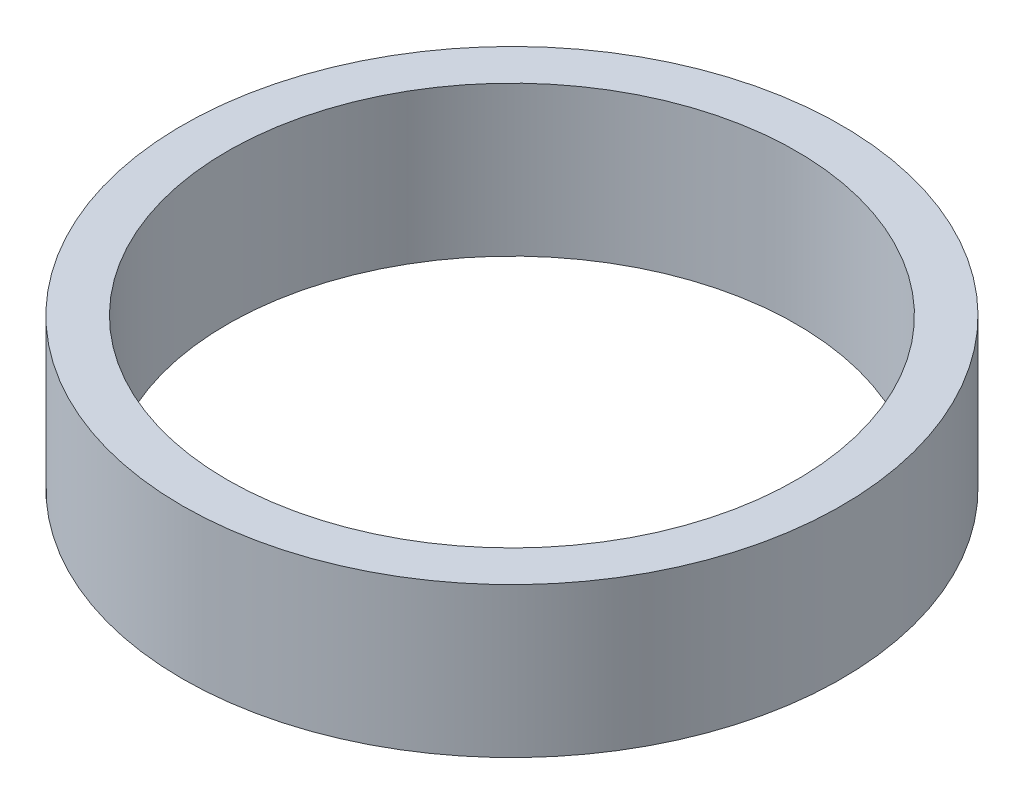
from build123d import *

# Parameters (mm, degrees)
SKETCH1_R           = 55
BOSS_EXTRUDE1_DEPTH = 25
SKETCH2_R           = 47.5
CUT_EXTRUDE1_DEPTH  = 82.700673192


with BuildPart() as part:
    # Sketch1 → Boss-Extrude1 (new body)
    with BuildSketch(Plane(origin=(0, 0, 0), x_dir=(1, 0, 0), z_dir=(0, 1, 0))):
        Circle(SKETCH1_R)
    extrude(amount=BOSS_EXTRUDE1_DEPTH)

    # Sketch2 → Cut-Extrude1 (cut, through all)
    with BuildSketch(Plane(origin=(0, 0, 0), x_dir=(1, 0, 0), z_dir=(0, 1, 0))):
        Circle(SKETCH2_R)
    extrude(amount=CUT_EXTRUDE1_DEPTH, mode=Mode.SUBTRACT)


solid = part.part
